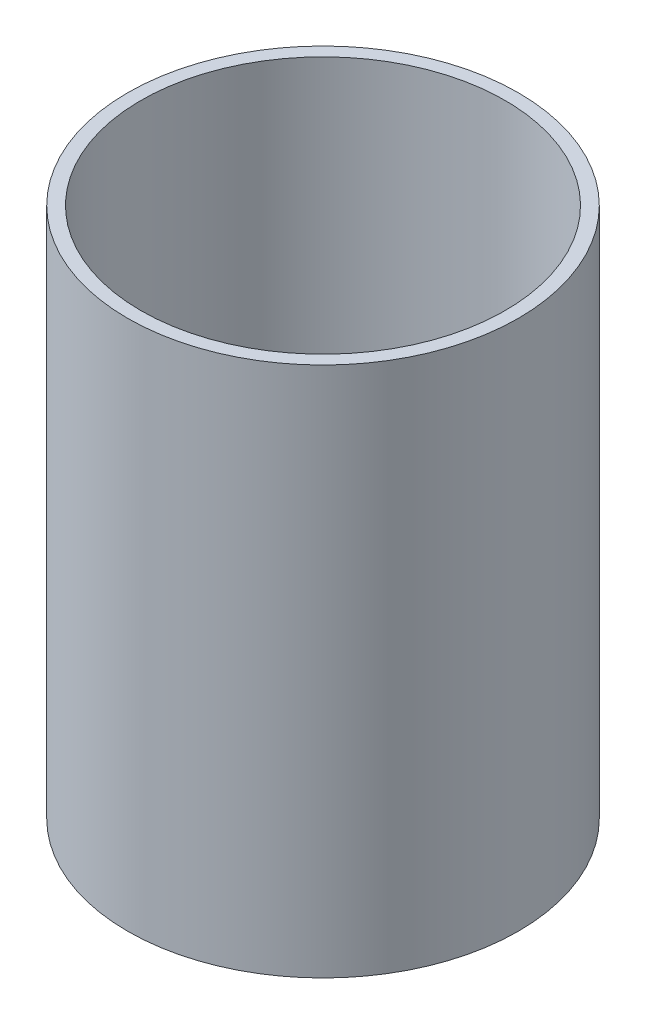
from build123d import *

# Parameters (mm, degrees)
ESQUISSE1_R        = 73.61
ESQUISSE1_R_2      = 68.61
BOSS_EXTRU_1_DEPTH = 200


with BuildPart() as part:
    # Esquisse1 → Boss.-Extru.1 (new body)
    with BuildSketch(Plane(origin=(0, 0, 0), x_dir=(1, 0, 0), z_dir=(0, 1, 0))):
        Circle(ESQUISSE1_R)
        Circle(ESQUISSE1_R_2, mode=Mode.SUBTRACT)
    extrude(amount=BOSS_EXTRU_1_DEPTH)


solid = part.part
